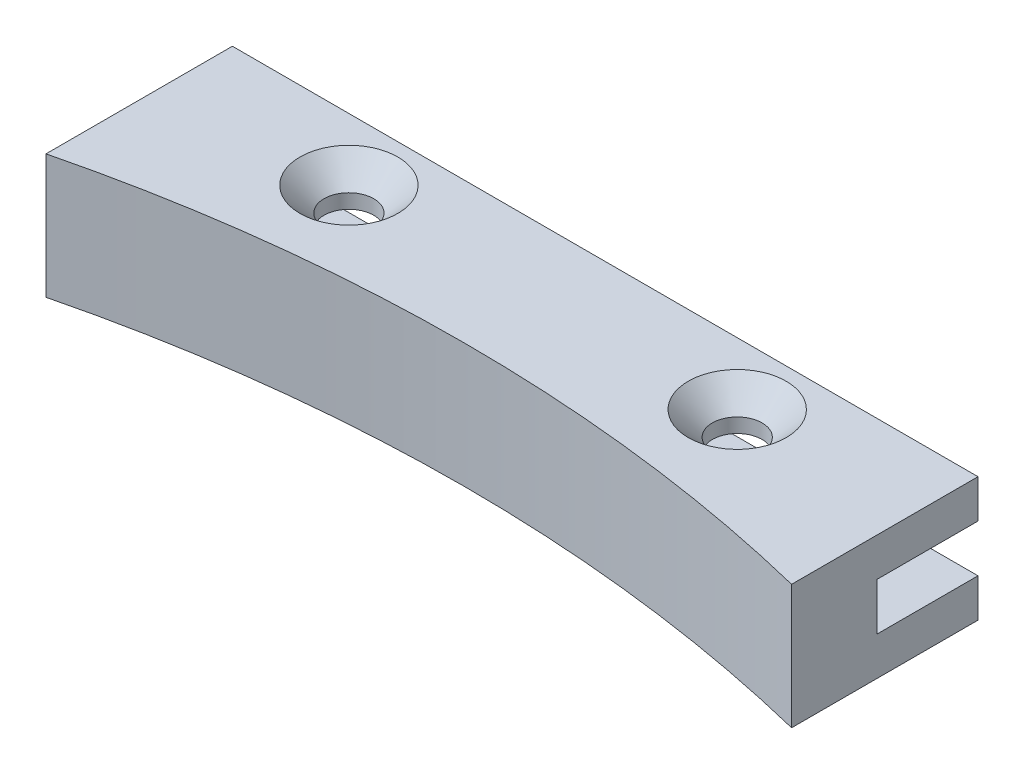
from build123d import *

# Parameters (mm, degrees)
BOSS_EXTRUDE1_DEPTH                             = 4
CSK_FOR_M3_FLAT_HEAD_MACHINE_SCREW1_D           = 3.2
CSK_FOR_M3_FLAT_HEAD_MACHINE_SCREW1_CSINK_D     = 6.3
CSK_FOR_M3_FLAT_HEAD_MACHINE_SCREW1_CSINK_ANGLE = 90
SKETCH9_W                                       = 6.5
SKETCH9_H                                       = 3.05
CUT_EXTRUDE2_DEPTH                              = 50.638694584


with BuildPart() as part:
    # Sketch1 → Boss-Extrude1 (new, symmetric)
    with BuildSketch(Plane(origin=(0, 0, 0), x_dir=(1, 0, 0), z_dir=(0, 1, 0))):
        with BuildLine():
            Line((-24, 0), (24, 0))
            Line((24, 0), (24, -12))
            ThreePointArc((24, -12), (0, -9.077288796), (-24, -12))
            Line((-24, -12), (-24, 0))
        make_face()
    extrude(amount=BOSS_EXTRUDE1_DEPTH, both=True)

    # CSK for M3 Flat Head Machine Screw1 (through all)
    with Locations(Plane(origin=(0, 4, 0), x_dir=(1, 0, 0), z_dir=(0, 1, 0))):
        with Locations((12.5, -4), (-12.5, -4)):
            CounterSinkHole(CSK_FOR_M3_FLAT_HEAD_MACHINE_SCREW1_D / 2, CSK_FOR_M3_FLAT_HEAD_MACHINE_SCREW1_CSINK_D / 2, counter_sink_angle=CSK_FOR_M3_FLAT_HEAD_MACHINE_SCREW1_CSINK_ANGLE)

    # Sketch9 → Cut-Extrude2 (cut, through all)
    with BuildSketch(Plane.ZY.offset(24)):
        with Locations((3.25, 0)):
            Rectangle(SKETCH9_W, SKETCH9_H)
    extrude(amount=-CUT_EXTRUDE2_DEPTH, mode=Mode.SUBTRACT)


solid = part.part
